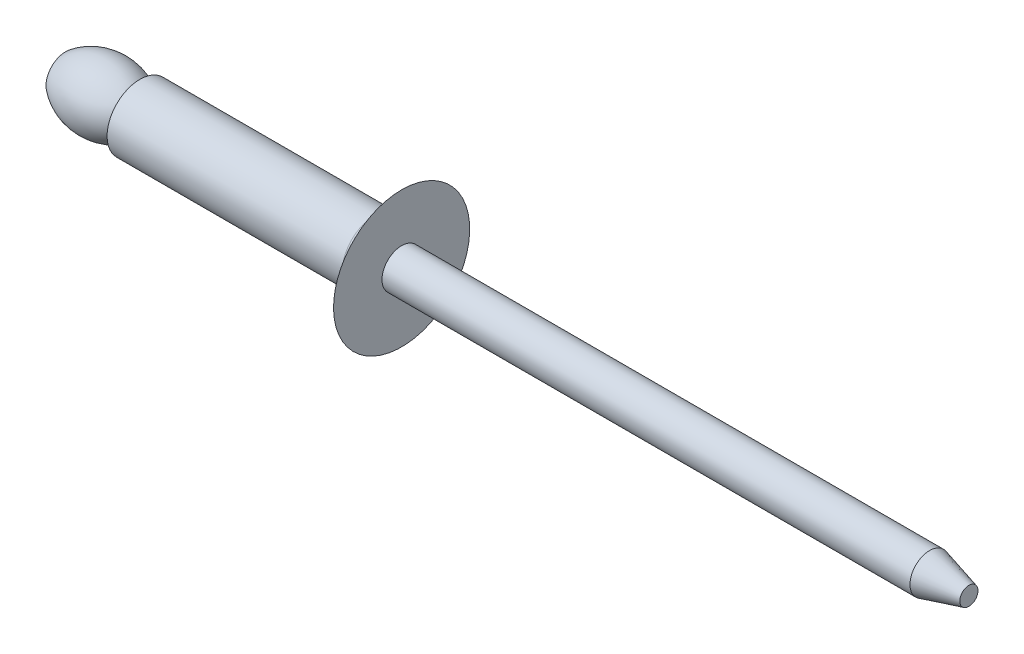
from build123d import *

# Parameters (mm, degrees)
FILLET1_R      = 0.5
CHAMFER1_SIZE  = 1.8
CHAMFER1_SIZE2 = 0.482308546


with BuildPart() as part:
    # Sketch1 → Base-Revolve (revolve)
    with BuildSketch(Plane(origin=(-30.238360927, 33.358360927, 0), x_dir=(0, -1, 0), z_dir=(0, 0, 1))):
        with BuildLine():
            Line((34.258360927, 33.638360927), (34.858360927, 33.638360927))
            Line((34.858360927, 33.638360927), (34.858360927, 44.703053491))
            Line((34.858360927, 44.703053491), (36.478360927, 45.638360927))
            Line((36.478360927, 45.638360927), (34.258360927, 45.638360927))
            Line((34.258360927, 45.638360927), (34.258360927, 71.638360927))
            Line((34.258360927, 71.638360927), (33.358360927, 71.638360927))
            Line((33.358360927, 71.638360927), (33.358360927, 30.238360927))
            Line((33.358360927, 30.238360927), (34.258360927, 30.238360927))
            ThreePointArc((34.258360927, 30.238360927), (34.858360927, 31.938360927), (34.258360927, 33.638360927))
        make_face()
    revolve(axis=Axis((43.645120624, 0, 0), (-1, 0, 0)))

    # Fillet1
    fillet1_edges = [part.edges().sort_by_distance(p)[0] for p in [
        (14.464692564, 1.5, 0),
    ]]
    fillet(fillet1_edges, radius=FILLET1_R)

    # Chamfer1
    chamfer1_edges = [part.edges().sort_by_distance(p)[0] for p in [
        (41.4, 0.9, 0),
    ]]
    chamfer1_side = [part.faces().sort_by_distance(p)[0] for p in [
        (28.4, 0.9, 0),
    ]]
    chamfer(chamfer1_edges, length=CHAMFER1_SIZE, length2=CHAMFER1_SIZE2, reference=chamfer1_side[0])


solid = part.part
